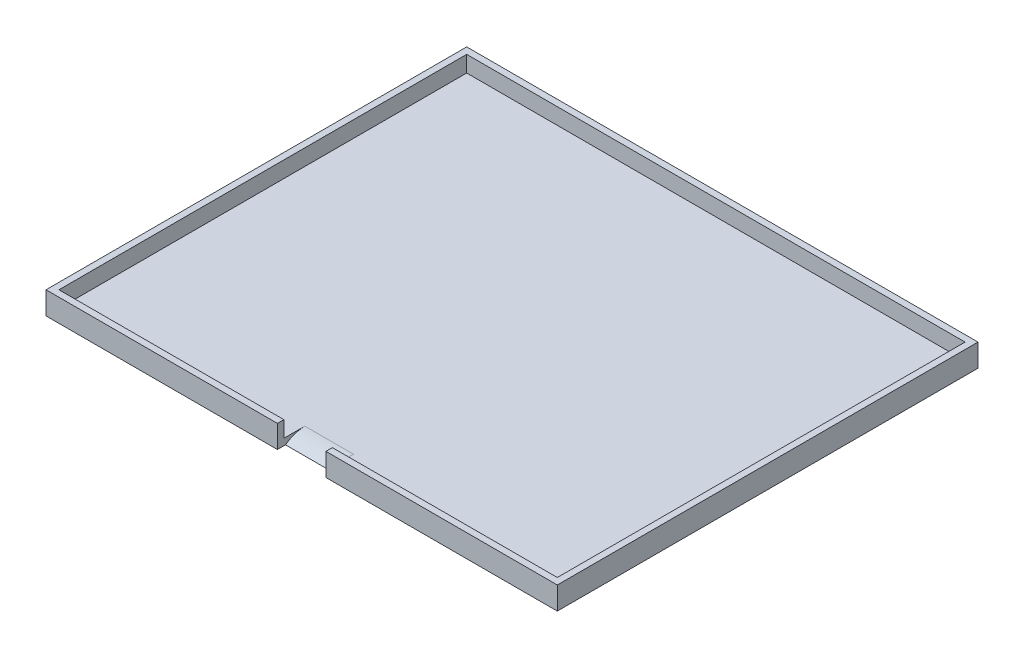
from build123d import *

# Parameters (mm, degrees)
ESQUISSE1_W             = 79
ESQUISSE1_H             = 65
BOSS_EXTRU_1_DEPTH      = 3.5
ESQUISSE2_W             = 77
ESQUISSE2_H             = 63
ENL_V_MAT_EXTRU_1_DEPTH = 2.5
ESQUISSE3_W             = 7.5
ESQUISSE3_H             = 7.5
ENL_V_MAT_EXTRU_2_DEPTH = 1.25
CONG_1_R                = 5


with BuildPart() as part:
    # Esquisse1 → Boss.-Extru.1 (new body)
    with BuildSketch(Plane(origin=(0, 0, 0), x_dir=(1, 0, 0), z_dir=(0, 1, 0))):
        Rectangle(ESQUISSE1_W, ESQUISSE1_H)
    extrude(amount=BOSS_EXTRU_1_DEPTH)

    # Esquisse2 → Enlèv. mat.-Extru.1 (cut)
    with BuildSketch(Plane(origin=(0, 3.5, 0), x_dir=(1, 0, 0), z_dir=(0, 1, 0))):
        Rectangle(ESQUISSE2_W, ESQUISSE2_H)
    extrude(amount=-ENL_V_MAT_EXTRU_1_DEPTH, mode=Mode.SUBTRACT)

    # Esquisse3 → Enlèv. mat.-Extru.2 (cut)
    with BuildSketch(Plane.XY.offset(32.5)):
        with Locations((0, 1.75)):
            Rectangle(ESQUISSE3_W, ESQUISSE3_H)
    extrude(amount=-ENL_V_MAT_EXTRU_2_DEPTH, mode=Mode.SUBTRACT)

    # Congé1
    # the kernel refuses this fillet: 5 mm, written as the material it takes off along each edge
    with BuildSketch(Plane(origin=(-3.75, 1, 31.25), x_dir=(0, -1, 0), z_dir=(1, 0, 0))) as cong_1_piece_1:
        with BuildLine():
            CenterArc((5, 3), CONG_1_R, 180, 36.869897646)
            Line((0, 3), (-0.1, 3))
            Line((-0.1, 3), (-0.1, 0))
            Line((-0.1, 0), (0, -0.1))
            ThreePointArc((0, -0.1), (0.5, -0.1), (0.92, -0.06))
            Line((0.92, -0.06), (1, 0))
        make_face()
    extrude(amount=7.5, mode=Mode.SUBTRACT)


solid = part.part
